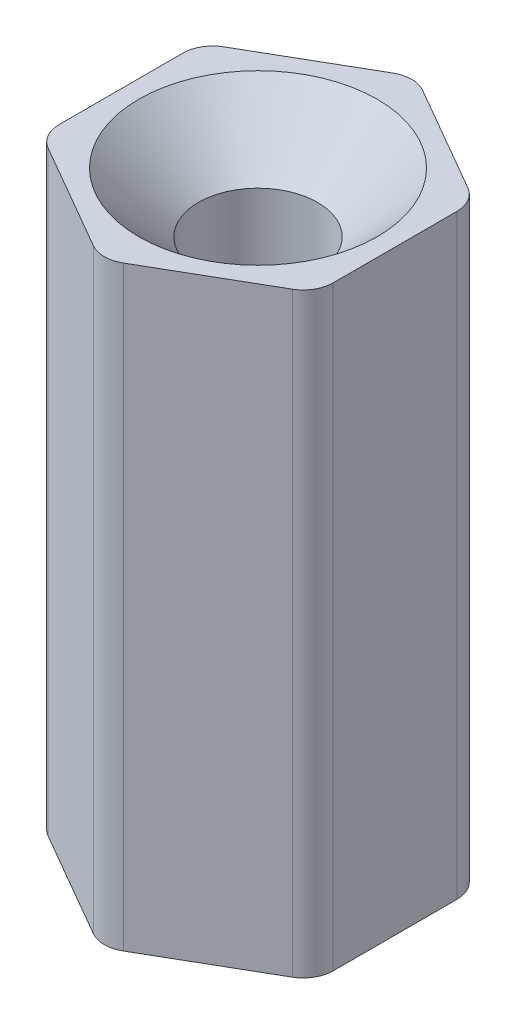
from build123d import *

# Parameters (mm, degrees)
BOSS_EXTRUDE1_DEPTH = 10
SKETCH2_R           = 1
CUT_EXTRUDE1_DEPTH  = 11.599213807
CHAMFER2_SIZE       = 1
FILLET1_R           = 0.5


with BuildPart() as part:
    # Sketch1 → Boss-Extrude1 (new body)
    with BuildSketch(Plane(origin=(0, 0, 0), x_dir=(1, 0, 0), z_dir=(0, 1, 0))):
        Polygon((0, 2.655811238), (-2.3, 1.327905619), (-2.3, -1.327905619), (0, -2.655811238), (2.3, -1.327905619), (2.3, 1.327905619), align=None)
    extrude(amount=BOSS_EXTRUDE1_DEPTH)

    # Sketch2 → Cut-Extrude1 (cut, through all)
    with BuildSketch(Plane(origin=(0, 10, 0), x_dir=(1, 0, 0), z_dir=(0, 1, 0))):
        Circle(SKETCH2_R)
    extrude(amount=-CUT_EXTRUDE1_DEPTH, mode=Mode.SUBTRACT)

    # Chamfer2
    chamfer2_edges = [part.edges().sort_by_distance(p)[0] for p in [
        (-1, 0, 0),
        (-1, 10, 0),
    ]]
    chamfer(chamfer2_edges, length=CHAMFER2_SIZE)

    # Fillet1
    fillet1_edges = [part.edges().sort_by_distance(p)[0] for p in [
        (0, 5, 2.655811238),
        (-2.3, 5, 1.327905619),
        (-2.3, 5, -1.327905619),
        (0, 5, -2.655811238),
        (2.3, 5, -1.327905619),
        (2.3, 5, 1.327905619),
    ]]
    fillet(fillet1_edges, radius=FILLET1_R)


solid = part.part
